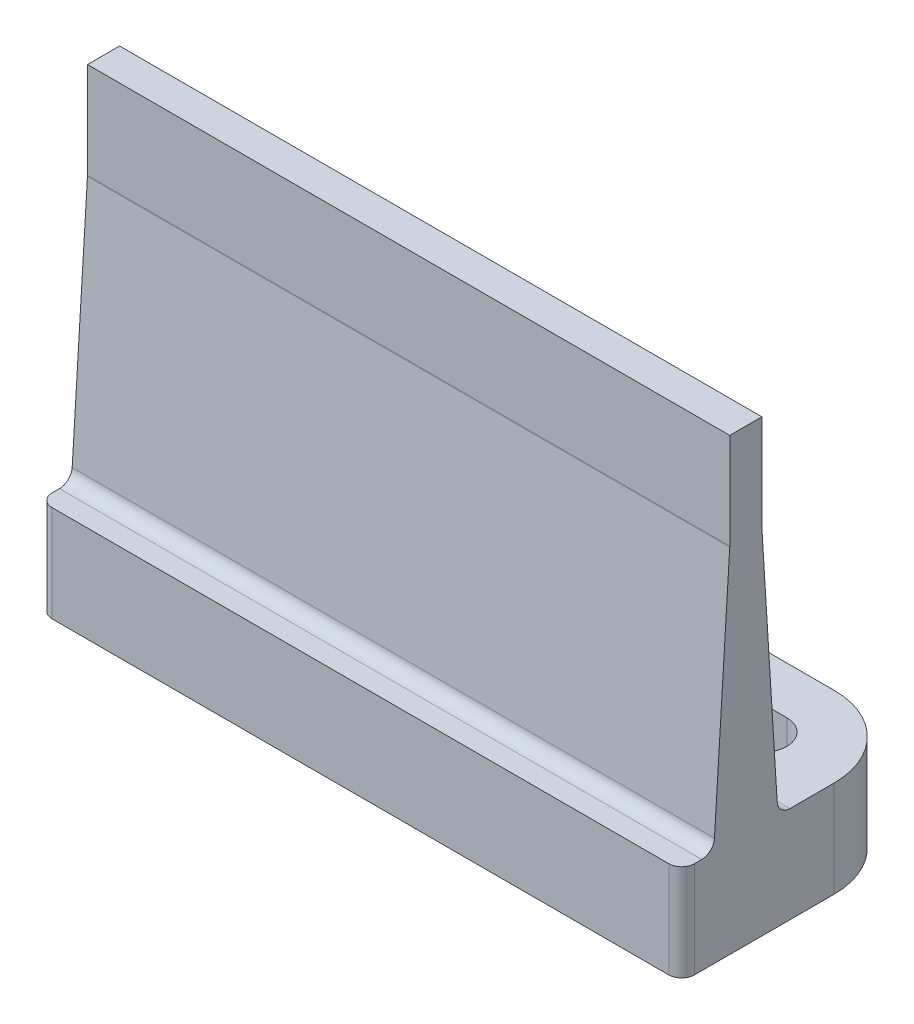
from build123d import *

# Parameters (mm, degrees)
BOSS_EXTRUDE1_DEPTH = 20
CUT_EXTRUDE1_REACH  = 33.532
FILLET1_R           = 5
FILLET2_R           = 0.79375


with BuildPart() as part:
    # Sketch1 → Boss-Extrude1 (new, symmetric)
    with BuildSketch(Plane(origin=(0, 0, 0), x_dir=(0, 0, -1), z_dir=(1, 0, 0))):
        Polygon((-4, 0), (10.5, 0), (10.5, 6), (2, 6), (1, 22), (1, 28), (-1, 28), (-1, 22), (-2, 6), (-4, 6), align=None)
    extrude(amount=BOSS_EXTRUDE1_DEPTH, both=True)

    # Sketch4 → Cut-Extrude1 (cut, up to next)
    with BuildSketch(Plane(origin=(0, 6, 0), x_dir=(1, 0, 0), z_dir=(0, 1, 0)), mode=Mode.PRIVATE) as cut_extrude1_sk1:
        with BuildLine():
            Line((-15, 7.55), (-5, 7.55))
            ThreePointArc((-5, 7.55), (-3.45, 6), (-5, 4.45))
            Line((-5, 4.45), (-15, 4.45))
            ThreePointArc((-15, 4.45), (-16.55, 6), (-15, 7.55))
        make_face()
    cut_extrude1_tool1 = extrude(cut_extrude1_sk1.sketch, amount=-CUT_EXTRUDE1_REACH, mode=Mode.PRIVATE) & part.part
    # Sketch4 → Cut-Extrude1 (cut, up to next)
    with BuildSketch(Plane(origin=(0, 6, 0), x_dir=(1, 0, 0), z_dir=(0, 1, 0)), mode=Mode.PRIVATE) as cut_extrude1_sk2:
        with BuildLine():
            Line((5, 7.55), (15, 7.55))
            ThreePointArc((15, 7.55), (16.55, 6), (15, 4.45))
            Line((15, 4.45), (5, 4.45))
            ThreePointArc((5, 4.45), (3.45, 6), (5, 7.55))
        make_face()
    cut_extrude1_tool2 = extrude(cut_extrude1_sk2.sketch, amount=-CUT_EXTRUDE1_REACH, mode=Mode.PRIVATE) & part.part
    add(cut_extrude1_tool1.solids().sort_by_distance((-10, 6, -6))[0], mode=Mode.SUBTRACT)
    add(cut_extrude1_tool2.solids().sort_by_distance((10, 6, -6))[0], mode=Mode.SUBTRACT)

    # Fillet1
    fillet1_edges = [part.edges().sort_by_distance(p)[0] for p in [
        (20, 3, -10.5),
        (-20, 3, -10.5),
    ]]
    fillet(fillet1_edges, radius=FILLET1_R)

    # Fillet2
    fillet2_edges = [part.edges().sort_by_distance(p)[0] for p in [
        (20, 3, 4),
        (-20, 3, 4),
        (0, 6, -2),
        (0, 22, -1),
        (0, 22, 1),
        (0, 6, 2),
    ]]
    fillet(fillet2_edges, radius=FILLET2_R)


solid = part.part
